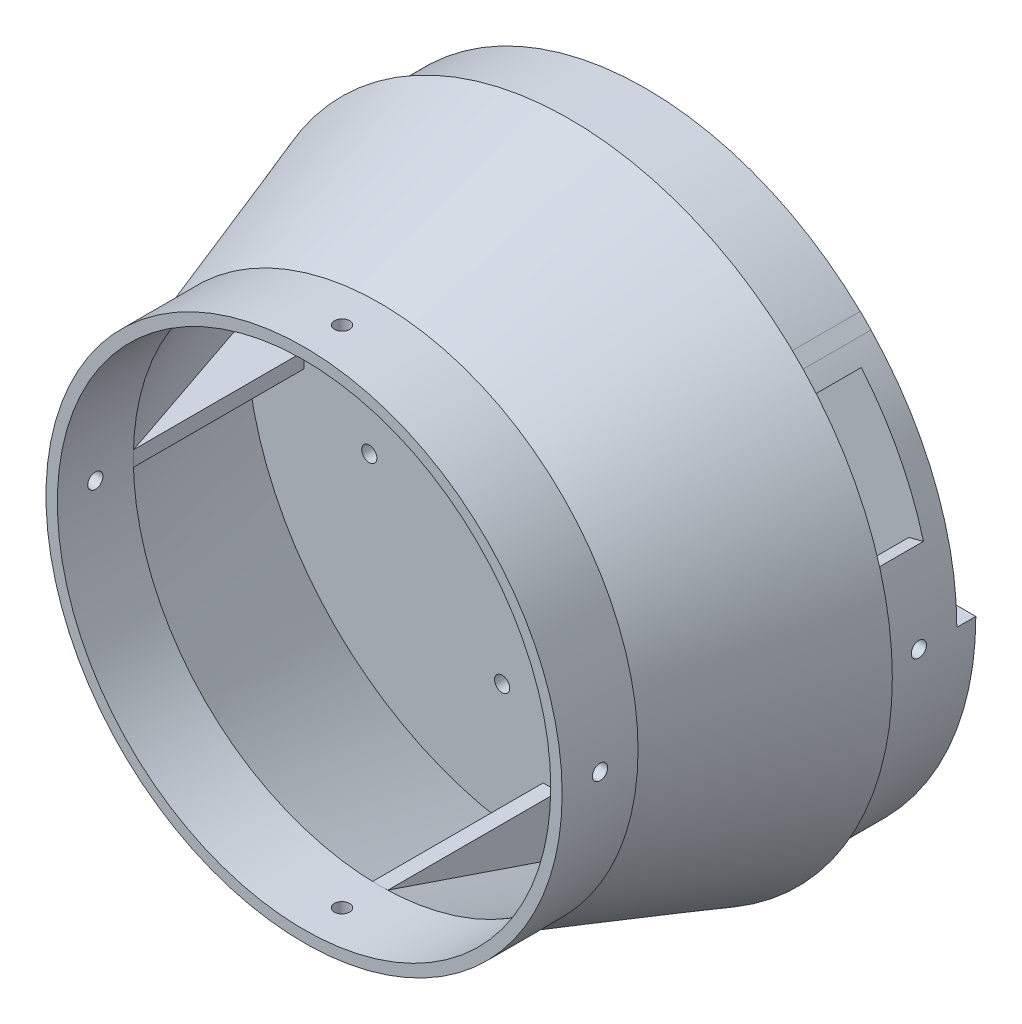
from build123d import *

# Parameters (mm, degrees)
BOSS_EXTRUDE5_DEPTH             = 2
CIRPATTERN3_COUNT               = 4
BOSS_EXTRUDE6_DEPTH             = 20
SKETCH14_R                      = 2
CUT_EXTRUDE1_DEPTH              = 95.00000000000004
CIRPATTERN4_COUNT               = 4
FILLET1_R                       = 5
SKETCH16_R                      = 2.000000000000001
CUT_EXTRUDE2_DEPTH              = 94.00000000000004
CIRPATTERN5_COUNT               = 2
CIRPATTERN5_ANGLE               = 90.0000000000002
CIRPATTERN5_THE_OTHER_WAY_COUNT = 2
CIRPATTERN5_THE_OTHER_WAY_ANGLE = 90.0000000000002
SKETCH17_R                      = 2.0000000000000018
SKETCH17_R_2                    = 1.9999999999984424
SKETCH17_R_3                    = 1.9999999999962943
SKETCH17_R_4                    = 1.9999999999898757
CUT_EXTRUDE4_DEPTH              = 900
CUT_EXTRUDE7_START              = -20
CUT_EXTRUDE7_DEPTH              = 20
BOSS_EXTRUDE8_START             = -6
SKETCH22_R                      = 81.99999999999999
SKETCH22_R_2                    = 60
BOSS_EXTRUDE8_DEPTH             = 6
SKETCH24_R                      = 25
CUT_EXTRUDE8_DEPTH              = 5
SKETCH28_W                      = 13.999999999999986
SKETCH28_H                      = 19.999999999999986
BOSS_EXTRUDE9_DEPTH             = 2
CIRPATTERN6_COUNT               = 4
BOSS_EXTRUDE10_DEPTH            = 5


with BuildPart() as part:
    # Sketch10 → Revolve2 (revolve)
    with BuildSketch(Plane(origin=(0, 0, 0), x_dir=(1, 0, 0), z_dir=(0, 1, 0))):
        Polygon((68, 0), (84.99999999999999, 50.000000000000014), (0, 50), (6.1e-16, 44.99999999999999), (80.29999999999998, 44.999999999999986), (65, -5.63e-15), (65, -20), (68, -20), align=None)
    revolve(axis=Axis((0, 0, 0), (0, 0, -1)))

    # Sketch12 → Boss-Extrude5 (add, symmetric)
    with BuildSketch(Plane(origin=(0, 0, 0), x_dir=(1, 0, 0), z_dir=(0, 1, 0))):
        Polygon((-80.29999999999998, 44.999999999999986), (-65, -6.94e-15), (-65, 44.999999999999986), align=None)
    boss_extrude5 = extrude(amount=BOSS_EXTRUDE5_DEPTH, both=True)

    # CirPattern3: Boss-Extrude5 ×4 about axis
    cirpattern3_axis = Axis((0, 0, -50.000000000000014), (0, 0, 1))
    for i in range(1, CIRPATTERN3_COUNT):
        add(boss_extrude5.rotate(cirpattern3_axis, i * 360 / CIRPATTERN3_COUNT))

    # Sketch13 → Boss-Extrude6 (add)
    with BuildSketch(Plane(origin=(0, 0, -50.00000000000001), x_dir=(-1, 0, 0), z_dir=(0, 0, -1))):
        with BuildLine():
            ThreePointArc((81.99999999999999, 0), (78.94301742396219, 22.181073012818818), (70, 42.70831300812521))
            ThreePointArc((70.00000000000001, 42.70831300812522), (-82, -3.73e-14), (70.00000000000003, -42.70831300812524))
            ThreePointArc((70, -42.70831300812522), (78.94301742396219, -22.18107301281883), (81.99999999999999, -2.008e-14))
        make_face()
        with BuildLine():
            ThreePointArc((70.00000000000001, -34.40930106817047), (-77.99999999999999, -3.02e-14), (70, 34.40930106817045))
            ThreePointArc((70.00000000000001, 34.40930106817046), (75.97367965289031, 17.663521732655667), (78, 0))
            ThreePointArc((78, -1.91e-14), (75.97367965289031, -17.663521732655717), (70.00000000000001, -34.40930106817047))
        make_face(mode=Mode.SUBTRACT)
    extrude(amount=BOSS_EXTRUDE6_DEPTH)

    # Sketch14 → Cut-Extrude1 (cut)
    with BuildSketch(Plane(origin=(0, 0, 0), x_dir=(1, 0, 0), z_dir=(0, 1, 0))):
        with Locations((0, -10)):
            Circle(SKETCH14_R)
    cut_extrude1 = extrude(amount=-CUT_EXTRUDE1_DEPTH, mode=Mode.SUBTRACT)

    # CirPattern4: Cut-Extrude1 ×4 about axis
    cirpattern4_axis = Axis((0, 0, 20), (0, 0, 1))
    for i in range(1, CIRPATTERN4_COUNT):
        add(cut_extrude1.rotate(cirpattern4_axis, i * 360 / CIRPATTERN4_COUNT), mode=Mode.SUBTRACT)

    # Fillet1
    fillet1_edges = [part.edges().sort_by_distance(p)[0] for p in [
        (70.00000000000136, -34.40930106817083, -50.00000000000001),
    ]]
    fillet(fillet1_edges, radius=FILLET1_R)

    # Sketch16 → Cut-Extrude2 (cut)
    with BuildSketch(Plane(origin=(0, 0, 0), x_dir=(1, 0, 0), z_dir=(0, 1, 0))):
        with Locations((0, 60.00000000000002)):
            Circle(SKETCH16_R)
    cut_extrude2 = extrude(amount=-CUT_EXTRUDE2_DEPTH, mode=Mode.SUBTRACT)

    # CirPattern5: Cut-Extrude2 ×2 about axis
    cirpattern5_axis = Axis((0, 0, -70), (0, 0, -1))
    for i in range(1, CIRPATTERN5_COUNT):
        add(cut_extrude2.rotate(cirpattern5_axis, i * CIRPATTERN5_ANGLE / (CIRPATTERN5_COUNT - 1)), mode=Mode.SUBTRACT)

    # CirPattern5 the other way: Cut-Extrude2 ×2 about axis
    cirpattern5_the_other_way_axis = Axis((0, 0, -70), (0, 0, 1))
    for i in range(1, CIRPATTERN5_THE_OTHER_WAY_COUNT):
        add(cut_extrude2.rotate(cirpattern5_the_other_way_axis, i * CIRPATTERN5_THE_OTHER_WAY_ANGLE / (CIRPATTERN5_THE_OTHER_WAY_COUNT - 1)), mode=Mode.SUBTRACT)

    # Sketch17 → Cut-Extrude4 (cut)
    with BuildSketch(Plane(origin=(0, 0, -50.00000000000001), x_dir=(-1, 0, 0), z_dir=(0, 0, -1))):
        with Locations((-47.81332840130892, 12.811542732574635)):
            Circle(SKETCH17_R)
        with Locations((-12.811542732574251, 47.813328401310926)):
            Circle(SKETCH17_R_2)
        with Locations((12.811542732575758, -47.81332840131803)):
            Circle(SKETCH17_R_3)
        with Locations((47.81332840131364, -12.811542732584947)):
            Circle(SKETCH17_R_4)
    extrude(amount=-CUT_EXTRUDE4_DEPTH, mode=Mode.SUBTRACT)

    # Sketch19 → Cut-Extrude7 (cut)
    with BuildSketch(Plane(origin=(0, 0, -70), x_dir=(-1, 0, 0), z_dir=(0, 0, -1)).offset(CUT_EXTRUDE7_START)):
        with BuildLine():
            Line((0, 0), (-79.20591775570364, 21.223161698406447))
            ThreePointArc((-79.20591775570364, 21.223161698406447), (-72.73488832061426, 37.86338628527262), (-62.81564433575629, 52.70858399429611))
            Line((-62.81564433575629, 52.70858399429611), (0, 0))
        make_face()
    cut_extrude7 = extrude(amount=CUT_EXTRUDE7_DEPTH, mode=Mode.SUBTRACT)

    # Mirror1: Cut-Extrude7 across plane
    add(cut_extrude7.mirror(Plane(origin=(0, 0, 0), x_dir=(0, 0, 1), z_dir=(1, 0, 0))), mode=Mode.SUBTRACT)

    # Sketch22 → Boss-Extrude8 (add)
    with BuildSketch(Plane(origin=(0, 0, -70), x_dir=(-1, 0, 0), z_dir=(0, 0, -1)).offset(BOSS_EXTRUDE8_START)):
        Circle(SKETCH22_R)
        Circle(SKETCH22_R_2, mode=Mode.SUBTRACT)
    extrude(amount=BOSS_EXTRUDE8_DEPTH)

    # Sketch24 → Cut-Extrude8 (cut)
    with BuildSketch(Plane(origin=(0, 0, -50.00000000000001), x_dir=(-1, 0, 0), z_dir=(0, 0, -1))):
        Circle(SKETCH24_R)
    extrude(amount=-CUT_EXTRUDE8_DEPTH, mode=Mode.SUBTRACT)

    # Sketch28 → Boss-Extrude9 (add, symmetric)
    with BuildSketch(Plane(origin=(0, 0, 0), x_dir=(0.7071067811865477, 0.7071067811865475, 0), z_dir=(-0.7071067811865475, 0.7071067811865477, 0))):
        with Locations((-75, 60.00000000000001)):
            Rectangle(SKETCH28_W, SKETCH28_H)
    boss_extrude9 = extrude(amount=BOSS_EXTRUDE9_DEPTH, both=True)

    # CirPattern6: Boss-Extrude9 ×4 about axis
    cirpattern6_axis = Axis((0, 0, -70), (0, 0, -1))
    for i in range(1, CIRPATTERN6_COUNT):
        add(boss_extrude9.rotate(cirpattern6_axis, i * 360 / CIRPATTERN6_COUNT))

    # Sketch29 → Boss-Extrude10 (add)
    with BuildSketch(Plane(origin=(0, 0, -70), x_dir=(-1, 0, 0), z_dir=(0, 0, -1))):
        with BuildLine():
            Line((79.20591775570358, 21.22316169840673), (75.82517736369185, 20.31729504054791))
            Line((75.82517736369185, 20.31729504054791), (75.00000000000001, 0))
            ThreePointArc((75.00000000000001, 0), (2.5439e-13, -75.00000000000001), (-75.00000000000001, -5.2372e-13))
            Line((-75.00000000000001, -5.2372e-13), (-81.99999999999999, -3.9762e-13))
            ThreePointArc((-81.99999999999999, -3.9762e-13), (10.703147762044456, -81.2984786326524), (79.20591775570358, 21.22316169840673))
        make_face()
    extrude(amount=BOSS_EXTRUDE10_DEPTH)


solid = part.part
